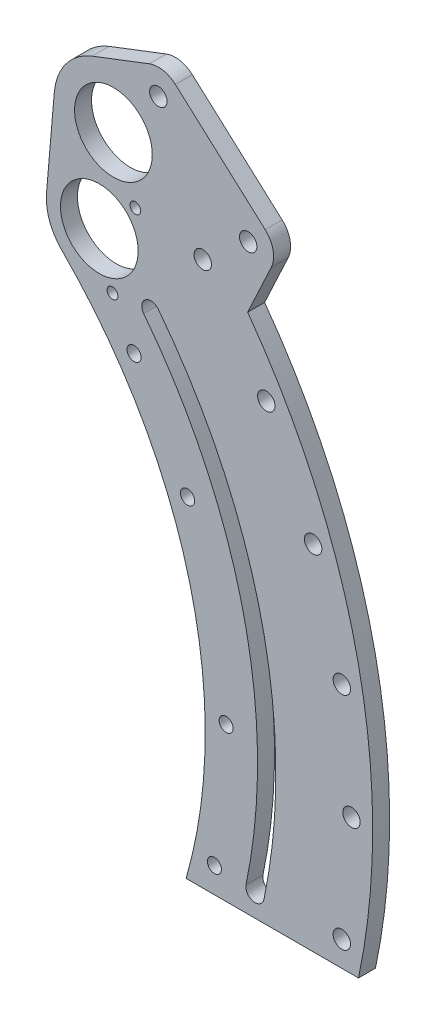
from build123d import *

# Parameters (mm, degrees)
SKETCH1_R           = 2.6289
SKETCH1_R_2         = 3.2639
SKETCH1_R_3         = 2.667
BOSS_EXTRUDE1_DEPTH = 6.35
BOSS_EXTRUDE2_START = -6.35
SKETCH3_R           = 14.5542
SKETCH3_R_2         = 3.2639
BOSS_EXTRUDE2_DEPTH = 6.35
SKETCH4_R           = 14.5542
SKETCH4_R_2         = 2.0193
CUT_EXTRUDE1_DEPTH  = 322.716169041


with BuildPart() as part:
    # Sketch1 → Boss-Extrude1 (new body)
    with BuildSketch(Plane.XY):
        with BuildLine():
            ThreePointArc((183.35625, 0), (181.552952325, -25.652288715), (176.178529946, -50.8))
            Line((176.178529946, -50.8), (240.761529124, -50.8))
            ThreePointArc((240.761529124, -50.8), (235.877364624, 70.061564101), (173.992462346, 173.992462346))
            Line((173.992462346, 173.992462346), (129.652447748, 129.652447748))
            ThreePointArc((129.652447748, 129.652447748), (169.399086533, 70.167399096), (183.35625, 0))
        make_face()
        with Locations((186.787775735, -41.275)):
            Circle(SKETCH1_R, mode=Mode.SUBTRACT)
        with BuildLine():
            ThreePointArc((198.61336608, -41.711026485), (201.859935486, -20.967721902), (202.946, 0))
            ThreePointArc((202.946, 0), (191.993196693, 65.769988136), (160.317011605, 124.440888401))
            ThreePointArc((160.317011605, 124.440888401), (160.923178893, 129.252192093), (165.734482585, 128.646024805))
            ThreePointArc((165.734482585, 128.646024805), (198.481076932, 67.99250338), (209.804, 0))
            ThreePointArc((209.804, 0), (208.692287116, -21.569601625), (205.368929989, -42.910616532))
            ThreePointArc((205.368929989, -42.910616532), (201.391341659, -45.688667392), (198.61336608, -41.711026485))
        make_face(mode=Mode.SUBTRACT)
        with Locations((234.507346186, -41.349972307)):
            Circle(SKETCH1_R_2, mode=Mode.SUBTRACT)
        with Locations((238.125, 0)):
            Circle(SKETCH1_R_2, mode=Mode.SUBTRACT)
        with Locations((191.177219016, 6.676055597)):
            Circle(SKETCH1_R, mode=Mode.SUBTRACT)
        with Locations((234.507346186, 41.349972307)):
            Circle(SKETCH1_R_2, mode=Mode.SUBTRACT)
        with Locations((156.698666372, 109.721587421)):
            Circle(SKETCH1_R, mode=Mode.SUBTRACT)
        with Locations((176.732380322, 73.20494884)):
            Circle(SKETCH1_R_3, mode=Mode.SUBTRACT)
        with Locations((182.414333018, 153.063799557)):
            Circle(SKETCH1_R_2, mode=Mode.SUBTRACT)
        with Locations((223.764305325, 81.443546629)):
            Circle(SKETCH1_R_2, mode=Mode.SUBTRACT)
        with Locations((206.222299276, 119.0625)):
            Circle(SKETCH1_R_2, mode=Mode.SUBTRACT)
    extrude(amount=BOSS_EXTRUDE1_DEPTH)

    # Sketch3 → Boss-Extrude2 (add)
    with BuildSketch(Plane.XY.offset(6.35).offset(BOSS_EXTRUDE2_START)):
        with BuildLine():
            Line((129.652447748, 129.652447748), (161.644610179, 161.644610179))
            Line((161.644610179, 161.644610179), (173.992462346, 173.992462346))
            ThreePointArc((173.992462346, 173.992462346), (187.203995727, 159.691633751), (199.243521921, 144.391041546))
            Line((199.243521921, 144.391041546), (208.072252438, 163.324315239))
            ThreePointArc((208.072252438, 163.324315239), (208.773335867, 169.249312232), (205.812262342, 174.428998606))
            Line((205.812262342, 174.428998606), (172.171515343, 204.711713553))
            ThreePointArc((172.171515343, 204.711713553), (167.533866317, 206.998129776), (162.384955615, 206.524625586))
            Line((162.384955615, 206.524625586), (140.998030433, 198.31353733))
            ThreePointArc((140.998030433, 198.31353733), (131.199359749, 190.920685757), (126.819367879, 179.454044017))
            Line((126.819367879, 179.454044017), (123.912144148, 145.370590574))
            ThreePointArc((123.912144148, 145.370590574), (125.044465056, 136.876859135), (129.652447748, 129.652447748))
        make_face()
        with Locations((148.963956123, 177.565172264)):
            Circle(SKETCH3_R, mode=Mode.SUBTRACT)
        with Locations((199.439670766, 167.349754182)):
            Circle(SKETCH3_R_2, mode=Mode.SUBTRACT)
        with Locations((165.798923767, 197.632469129)):
            Circle(SKETCH3_R_2, mode=Mode.SUBTRACT)
    extrude(amount=BOSS_EXTRUDE2_DEPTH)

    # Sketch4 → Cut-Extrude1 (cut, through all)
    with BuildSketch(Plane.XY.offset(6.35)):
        with Locations((143.684097937, 143.684097937)):
            Circle(SKETCH4_R)
        with Locations((157.154482119, 157.154482119)):
            Circle(SKETCH4_R_2)
        with Locations((148.614600746, 125.283210946)):
            Circle(SKETCH4_R_2)
    extrude(amount=-CUT_EXTRUDE1_DEPTH, mode=Mode.SUBTRACT)


solid = part.part
